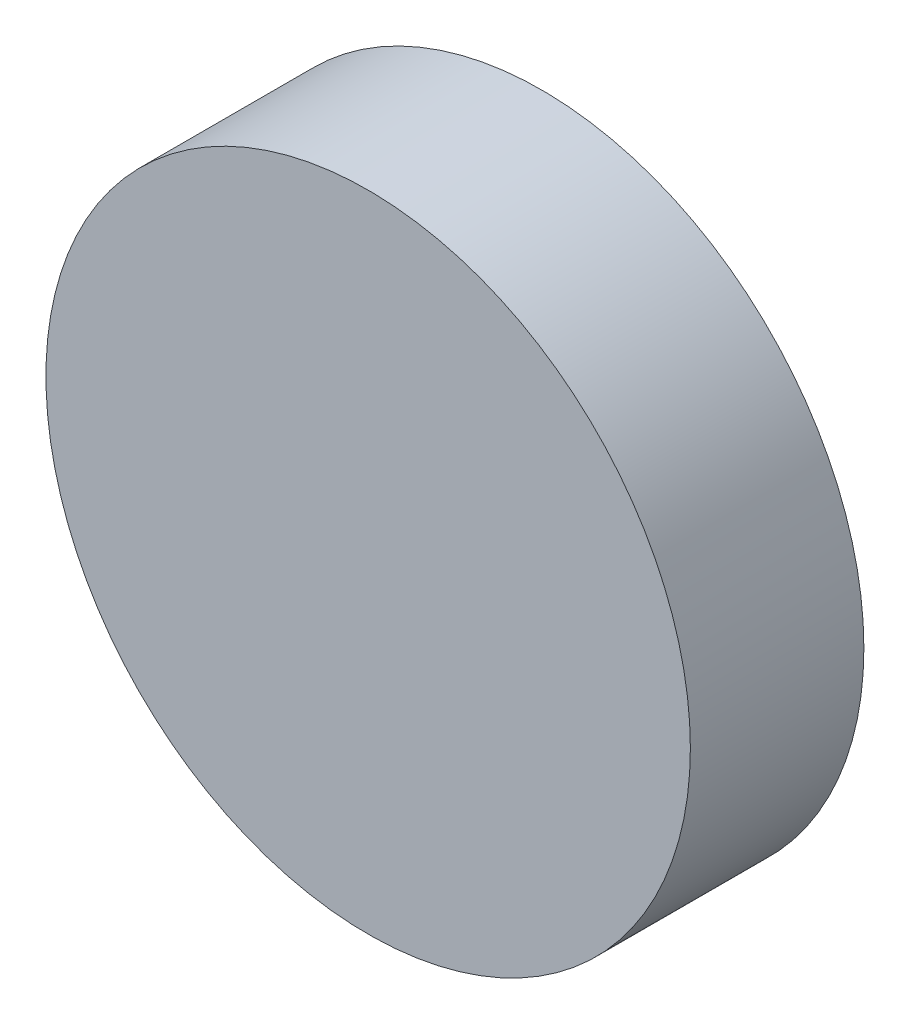
from build123d import *

# Parameters (mm, degrees)
SKETCH1_R           = 6.5
BOSS_EXTRUDE1_DEPTH = 3.5


with BuildPart() as part:
    # Sketch1 → Boss-Extrude1 (new body)
    with BuildSketch(Plane.XY):
        Circle(SKETCH1_R)
    extrude(amount=BOSS_EXTRUDE1_DEPTH)


solid = part.part
